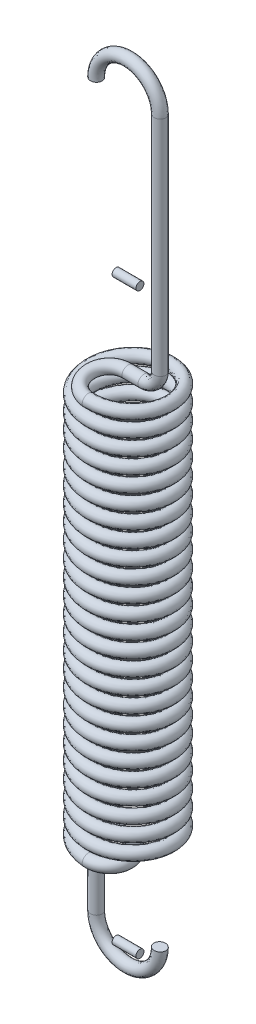
from build123d import *

# Parameters (mm, degrees)
SWEEP1_PITCH               = 2
SWEEP1_HEIGHT              = 50
SWEEP1_RADIUS              = 5
SWEEP1_PROFILE_R           = 0.75
SKETCH6_R                  = 0.75
REVOLVE1_ANGLE             = 180
SKETCH10_R                 = 0.75
REVOLVE2_ANGLE             = 180
SKETCH11_R                 = 0.75
SKETCH8_R                  = 0.75
BOSS_EXTRUDE1_DEPTH        = 1.5
BOSS_EXTRUDE1_DEPTH_BACK   = 1.5
SKETCH16_R                 = 0.5
BOSS_EXTRUDE1_2_DEPTH      = 1.5
BOSS_EXTRUDE1_2_DEPTH_BACK = 1.5


with BuildPart() as part:
    # Sweep1: sweep along a helix
    with BuildLine() as sweep1_path:
        Helix(SWEEP1_PITCH, SWEEP1_HEIGHT, SWEEP1_RADIUS, center=(0, 0, 0), direction=(0, 1, 0), lefthand=True)
    # Sweep1 profile (on start of the path) → Sweep1 (sweep)
    with BuildSketch(Plane(origin=(0, 0, 5), x_dir=(-0.06353336191093463, -0.9979797151867839, 0), z_dir=(-0.9979797151867839, 0.06353336191093463, 9.100862826903568e-13))):
        Circle(SWEEP1_PROFILE_R)
    sweep(path=sweep1_path.line, is_frenet=True)

    # Sketch6 → Revolve1 (revolve)
    with BuildSketch(Plane(origin=(-3.170250321, 0.201824404, 0), x_dir=(-0.008040520685550952, -0.1263002035838172, 0.9919594793144484), z_dir=(-0.9979797151867817, 0.06353336191096715, 0))):
        with Locations((-1.355212783, 50.130551345)):
            Circle(SKETCH6_R)
    revolve(axis=Axis((-1.692671204, 23.411582901, -0.919326921), (-0.06302252060029935, -0.9899554386430616, -0.126555882511278)), revolution_arc=REVOLVE1_ANGLE)

    # Sketch10 → Revolve2 (revolve)
    with BuildSketch(Plane(origin=(0, 0, 0), x_dir=(0, 0, -1), z_dir=(0.9979797151867819, -0.06353336191096717, 0))):
        with Locations((-5, 0)):
            Circle(SKETCH10_R)
    revolve(axis=Axis((1.544524787, 24.261338626, 2.5), (0.06353336191096716, 0.9979797151867819, 0)), revolution_arc=REVOLVE2_ANGLE)

    # Sweep3: sweep along a path in Sketch13
    with BuildLine(Plane.XY) as sweep3_path:
        Line((0, 0), (-2, 0))
        ThreePointArc((-2, 0), (-3.414213562, -0.585786438), (-4, -2))
        Line((-4, -2), (-4, -10))
        ThreePointArc((-4, -10), (0, -14), (4, -10))
    # Sketch11 → Sweep3 (sweep)
    with BuildSketch(Plane(origin=(0, 0, 0), x_dir=(0, 0, 1), z_dir=(-0.9979797151867819, 0.06353336191096716, 6.98296267768627e-15))):
        Circle(SKETCH11_R)
    sweep(path=sweep3_path.line)

    # Sweep4: sweep along a path in Sketch18
    with BuildLine(Plane.XY) as sweep4_path:
        Line((0.040202603, 50.631501018), (2.040202603, 50.631501018))
        ThreePointArc((2.040202603, 50.631501018), (3.454416166, 51.217287456), (4.040202603, 52.631501018))
        Line((4.040202603, 52.631501018), (4.040202603, 80.631501018))
        ThreePointArc((4.040202603, 80.631501018), (0.040202603, 84.631501018), (-3.959797397, 80.631501018))
    # Sketch8 → Sweep4 (sweep)
    with BuildSketch(Plane(origin=(-3.170250321, 0.201824404, 0), x_dir=(0.008040520685557979, 0.12630020358381763, -0.9919594793144484), z_dir=(0.9979797151867817, -0.063533361910968, 7.011752289898254e-15))):
        with Locations((6.355212783, 50.130551345)):
            Circle(SKETCH8_R)
    sweep(path=sweep4_path.line)


with BuildPart() as body_2:
    # Sketch16 → Boss-Extrude1 (new, two sides: drawn at the far end of the back side and taken through both)
    with BuildSketch(Plane(origin=(0, 0, 0), x_dir=(0, 0, -1), z_dir=(1, 0, 0)).offset(-BOSS_EXTRUDE1_DEPTH_BACK)):
        with Locations((0, -12)):
            Circle(SKETCH16_R)
    extrude(amount=BOSS_EXTRUDE1_DEPTH + BOSS_EXTRUDE1_DEPTH_BACK)


with BuildPart() as body_3:
    # Sketch16 → Boss-Extrude1 2 (new, two sides: drawn at the far end of the back side and taken through both)
    with BuildSketch(Plane(origin=(0, 0, 0), x_dir=(0, 0, -1), z_dir=(1, 0, 0)).offset(-BOSS_EXTRUDE1_2_DEPTH_BACK)):
        with Locations((0, 60.631501018)):
            Circle(SKETCH16_R)
    extrude(amount=BOSS_EXTRUDE1_2_DEPTH + BOSS_EXTRUDE1_2_DEPTH_BACK)


solid = Compound([part.part, body_2.part, body_3.part])
